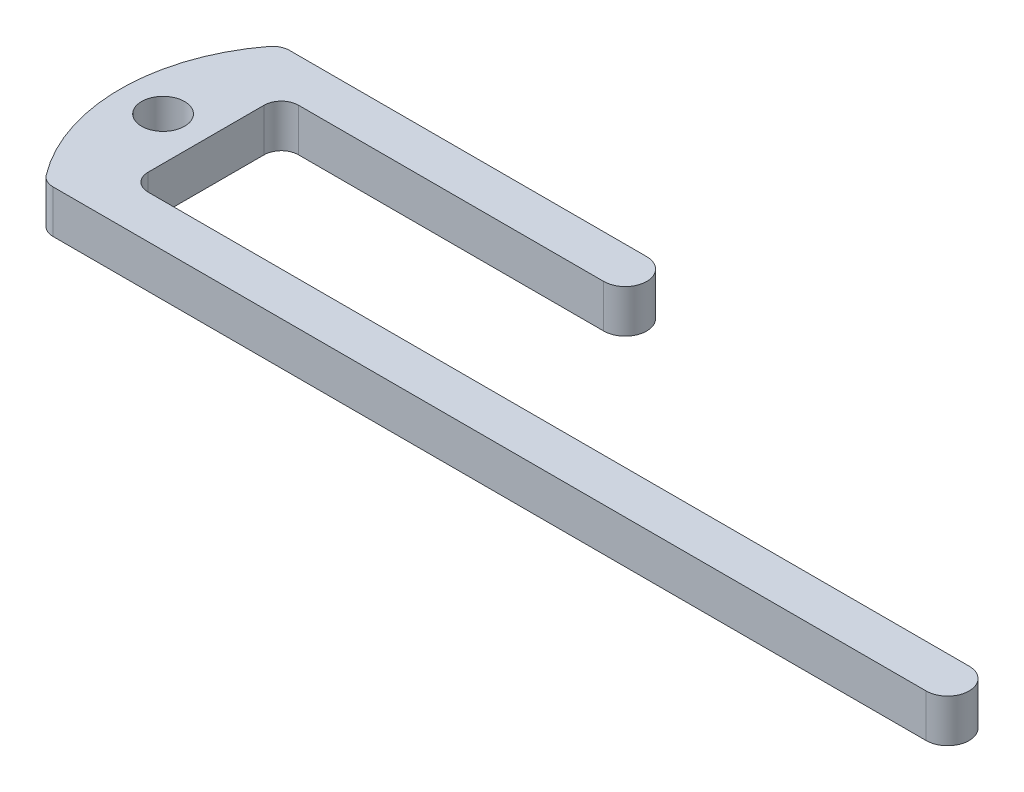
from build123d import *

# Parameters (mm, degrees)
SKETCH1_R           = 3.175
BOSS_EXTRUDE1_DEPTH = 3.175
FILLET1_R           = 2.54


with BuildPart() as part:
    # Sketch1 → Boss-Extrude1 (new, symmetric)
    with BuildSketch(Plane(origin=(0, 0, 0), x_dir=(1, 0, 0), z_dir=(0, 1, 0))):
        with BuildLine():
            Line((-3.175, 31.75), (50.8, 31.75))
            ThreePointArc((50.8, 31.75), (53.975, 28.575), (50.8, 25.4))
            Line((50.8, 25.4), (3.175, 25.4))
            Line((3.175, 25.4), (3.175, 3.175))
            Line((3.175, 3.175), (127, 3.175))
            ThreePointArc((127, 3.175), (130.175, 0), (127, -3.175))
            Line((127, -3.175), (-3.175, -3.175))
            ThreePointArc((-3.175, -3.175), (-9.525, 14.2875), (-3.175, 31.75))
        make_face()
        with Locations((-3.175, 14.2875)):
            Circle(SKETCH1_R, mode=Mode.SUBTRACT)
    extrude(amount=BOSS_EXTRUDE1_DEPTH, both=True)

    # Fillet1
    fillet1_edges = [part.edges().sort_by_distance(p)[0] for p in [
        (-3.175, 0, -31.75),
        (-3.175, 0, 3.175),
        (3.175, 0, -3.175),
        (3.175, 0, -25.4),
    ]]
    fillet(fillet1_edges, radius=FILLET1_R)


solid = part.part
